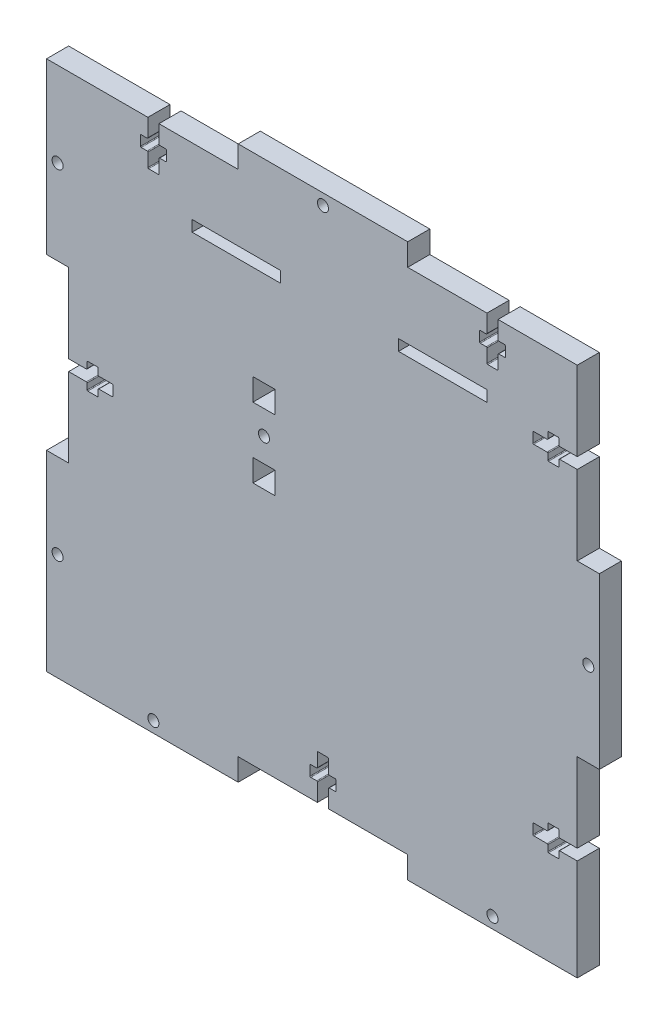
from build123d import *

# Parameters (mm, degrees)
BOX_SIDE_DEPTH       = 6
SKETCH2_R            = 1.5
SCREW_CUT_OUTS_DEPTH = 107.235587258
SKETCH3_R            = 1.5
SKETCH3_W            = 24
SKETCH3_H            = 3
SKETCH3_W_2          = 6
SKETCH3_H_2          = 6
GROOVES_DEPTH        = 107.235587258


with BuildPart() as part:
    # Sketch1 → Box Side (new body)
    with BuildSketch(Plane.XY):
        Polygon((-69, 69), (-23, 69), (-23, 75), (23, 75), (23, 69), (69, 69), (69, 23), (75, 23), (75, -23), (69, -23), (69, -69), (69, -75), (23, -75), (23, -69), (-23, -69), (-23, -75), (-69, -75), (-75, -75), (-75, -69), (-75, -23), (-69, -23), (-69, 23), (-75, 23), (-75, 69), align=None)
    extrude(amount=BOX_SIDE_DEPTH)

    # Sketch2 → Screw Cut-outs (cut, through all)
    with BuildSketch(Plane.XY.offset(6)):
        with Locations((0, 72)):
            Circle(SKETCH2_R)
        with Locations((72, 0)):
            Circle(SKETCH2_R)
        with Locations((-46, -72)):
            Circle(SKETCH2_R)
        with Locations((46, -72)):
            Circle(SKETCH2_R)
        with Locations((-72, 46)):
            Circle(SKETCH2_R)
        with Locations((-72, -46)):
            Circle(SKETCH2_R)
        with BuildLine():
            Line((-44.5, 69), (-44.5, 64.2))
            ThreePointArc((-44.5, 64.2), (-44.441421356, 64.058578644), (-44.3, 64))
            Line((-44.3, 64), (-42.7, 64))
            ThreePointArc((-42.7, 64), (-42.558578644, 63.941421356), (-42.5, 63.8))
            Line((-42.5, 63.8), (-42.5, 61.2))
            ThreePointArc((-42.5, 61.2), (-42.558578644, 61.058578644), (-42.7, 61))
            Line((-42.7, 61), (-44.3, 61))
            ThreePointArc((-44.3, 61), (-44.441421356, 60.941421356), (-44.5, 60.8))
            Line((-44.5, 60.8), (-44.5, 57.2))
            ThreePointArc((-44.5, 57.2), (-44.558578644, 57.058578644), (-44.7, 57))
            Line((-44.7, 57), (-47.3, 57))
            ThreePointArc((-47.3, 57), (-47.441421356, 57.058578644), (-47.5, 57.2))
            Line((-47.5, 57.2), (-47.5, 60.8))
            ThreePointArc((-47.5, 60.8), (-47.558578644, 60.941421356), (-47.7, 61))
            Line((-47.7, 61), (-49.3, 61))
            ThreePointArc((-49.3, 61), (-49.441421356, 61.058578644), (-49.5, 61.2))
            Line((-49.5, 61.2), (-49.5, 63.8))
            ThreePointArc((-49.5, 63.8), (-49.441421356, 63.941421356), (-49.3, 64))
            Line((-49.3, 64), (-47.7, 64))
            ThreePointArc((-47.7, 64), (-47.558578644, 64.058578644), (-47.5, 64.2))
            Line((-47.5, 64.2), (-47.5, 69))
            Line((-47.5, 69), (-44.5, 69))
        make_face()
        with BuildLine():
            Line((47.5, 69), (47.5, 64.2))
            ThreePointArc((47.5, 64.2), (47.558578644, 64.058578644), (47.7, 64))
            Line((47.7, 64), (49.3, 64))
            ThreePointArc((49.3, 64), (49.441421356, 63.941421356), (49.5, 63.8))
            Line((49.5, 63.8), (49.5, 61.2))
            ThreePointArc((49.5, 61.2), (49.441421356, 61.058578644), (49.3, 61))
            Line((49.3, 61), (47.7, 61))
            ThreePointArc((47.7, 61), (47.558578644, 60.941421356), (47.5, 60.8))
            Line((47.5, 60.8), (47.5, 57.2))
            ThreePointArc((47.5, 57.2), (47.441421356, 57.058578644), (47.3, 57))
            Line((47.3, 57), (44.7, 57))
            ThreePointArc((44.7, 57), (44.558578644, 57.058578644), (44.5, 57.2))
            Line((44.5, 57.2), (44.5, 60.8))
            ThreePointArc((44.5, 60.8), (44.441421356, 60.941421356), (44.3, 61))
            Line((44.3, 61), (42.7, 61))
            ThreePointArc((42.7, 61), (42.558578644, 61.058578644), (42.5, 61.2))
            Line((42.5, 61.2), (42.5, 63.8))
            ThreePointArc((42.5, 63.8), (42.558578644, 63.941421356), (42.7, 64))
            Line((42.7, 64), (44.3, 64))
            ThreePointArc((44.3, 64), (44.441421356, 64.058578644), (44.5, 64.2))
            Line((44.5, 64.2), (44.5, 69))
            Line((44.5, 69), (47.5, 69))
        make_face()
        with BuildLine():
            Line((69, 44.5), (64.2, 44.5))
            ThreePointArc((64.2, 44.5), (64.058578644, 44.441421356), (64, 44.3))
            Line((64, 44.3), (64, 42.7))
            ThreePointArc((64, 42.7), (63.941421356, 42.558578644), (63.8, 42.5))
            Line((63.8, 42.5), (61.2, 42.5))
            ThreePointArc((61.2, 42.5), (61.058578644, 42.558578644), (61, 42.7))
            Line((61, 42.7), (61, 44.3))
            ThreePointArc((61, 44.3), (60.941421356, 44.441421356), (60.8, 44.5))
            Line((60.8, 44.5), (57.2, 44.5))
            ThreePointArc((57.2, 44.5), (57.058578644, 44.558578644), (57, 44.7))
            Line((57, 44.7), (57, 47.3))
            ThreePointArc((57, 47.3), (57.058578644, 47.441421356), (57.2, 47.5))
            Line((57.2, 47.5), (60.8, 47.5))
            ThreePointArc((60.8, 47.5), (60.941421356, 47.558578644), (61, 47.7))
            Line((61, 47.7), (61, 49.3))
            ThreePointArc((61, 49.3), (61.058578644, 49.441421356), (61.2, 49.5))
            Line((61.2, 49.5), (63.8, 49.5))
            ThreePointArc((63.8, 49.5), (63.941421356, 49.441421356), (64, 49.3))
            Line((64, 49.3), (64, 47.7))
            ThreePointArc((64, 47.7), (64.058578644, 47.558578644), (64.2, 47.5))
            Line((64.2, 47.5), (69, 47.5))
            Line((69, 47.5), (69, 44.5))
        make_face()
        with BuildLine():
            Line((69, -47.5), (64.2, -47.5))
            ThreePointArc((64.2, -47.5), (64.058578644, -47.558578644), (64, -47.7))
            Line((64, -47.7), (64, -49.3))
            ThreePointArc((64, -49.3), (63.941421356, -49.441421356), (63.8, -49.5))
            Line((63.8, -49.5), (61.2, -49.5))
            ThreePointArc((61.2, -49.5), (61.058578644, -49.441421356), (61, -49.3))
            Line((61, -49.3), (61, -47.7))
            ThreePointArc((61, -47.7), (60.941421356, -47.558578644), (60.8, -47.5))
            Line((60.8, -47.5), (57.2, -47.5))
            ThreePointArc((57.2, -47.5), (57.058578644, -47.441421356), (57, -47.3))
            Line((57, -47.3), (57, -44.7))
            ThreePointArc((57, -44.7), (57.058578644, -44.558578644), (57.2, -44.5))
            Line((57.2, -44.5), (60.8, -44.5))
            ThreePointArc((60.8, -44.5), (60.941421356, -44.441421356), (61, -44.3))
            Line((61, -44.3), (61, -42.7))
            ThreePointArc((61, -42.7), (61.058578644, -42.558578644), (61.2, -42.5))
            Line((61.2, -42.5), (63.8, -42.5))
            ThreePointArc((63.8, -42.5), (63.941421356, -42.558578644), (64, -42.7))
            Line((64, -42.7), (64, -44.3))
            ThreePointArc((64, -44.3), (64.058578644, -44.441421356), (64.2, -44.5))
            Line((64.2, -44.5), (69, -44.5))
            Line((69, -44.5), (69, -47.5))
        make_face()
        with BuildLine():
            Line((-1.5, -69), (1.5, -69))
            Line((1.5, -69), (1.5, -64.2))
            ThreePointArc((1.5, -64.2), (1.558578644, -64.058578644), (1.7, -64))
            Line((1.7, -64), (3.3, -64))
            ThreePointArc((3.3, -64), (3.441421356, -63.941421356), (3.5, -63.8))
            Line((3.5, -63.8), (3.5, -61.2))
            ThreePointArc((3.5, -61.2), (3.441421356, -61.058578644), (3.3, -61))
            Line((3.3, -61), (1.7, -61))
            ThreePointArc((1.7, -61), (1.558578644, -60.941421356), (1.5, -60.8))
            Line((1.5, -60.8), (1.5, -57.2))
            ThreePointArc((1.5, -57.2), (1.441421356, -57.058578644), (1.3, -57))
            Line((1.3, -57), (-1.3, -57))
            ThreePointArc((-1.3, -57), (-1.441421356, -57.058578644), (-1.5, -57.2))
            Line((-1.5, -57.2), (-1.5, -60.8))
            ThreePointArc((-1.5, -60.8), (-1.558578644, -60.941421356), (-1.7, -61))
            Line((-1.7, -61), (-3.3, -61))
            ThreePointArc((-3.3, -61), (-3.441421356, -61.058578644), (-3.5, -61.2))
            Line((-3.5, -61.2), (-3.5, -63.8))
            ThreePointArc((-3.5, -63.8), (-3.441421356, -63.941421356), (-3.3, -64))
            Line((-3.3, -64), (-1.7, -64))
            ThreePointArc((-1.7, -64), (-1.558578644, -64.058578644), (-1.5, -64.2))
            Line((-1.5, -64.2), (-1.5, -69))
        make_face()
        with BuildLine():
            Line((-69, -1.5), (-64.2, -1.5))
            ThreePointArc((-64.2, -1.5), (-64.058578644, -1.558578644), (-64, -1.7))
            Line((-64, -1.7), (-64, -3.3))
            ThreePointArc((-64, -3.3), (-63.941421356, -3.441421356), (-63.8, -3.5))
            Line((-63.8, -3.5), (-61.2, -3.5))
            ThreePointArc((-61.2, -3.5), (-61.058578644, -3.441421356), (-61, -3.3))
            Line((-61, -3.3), (-61, -1.7))
            ThreePointArc((-61, -1.7), (-60.941421356, -1.558578644), (-60.8, -1.5))
            Line((-60.8, -1.5), (-57.2, -1.5))
            ThreePointArc((-57.2, -1.5), (-57.058578644, -1.441421356), (-57, -1.3))
            Line((-57, -1.3), (-57, 1.3))
            ThreePointArc((-57, 1.3), (-57.058578644, 1.441421356), (-57.2, 1.5))
            Line((-57.2, 1.5), (-60.8, 1.5))
            ThreePointArc((-60.8, 1.5), (-60.941421356, 1.558578644), (-61, 1.7))
            Line((-61, 1.7), (-61, 3.3))
            ThreePointArc((-61, 3.3), (-61.058578644, 3.441421356), (-61.2, 3.5))
            Line((-61.2, 3.5), (-63.8, 3.5))
            ThreePointArc((-63.8, 3.5), (-63.941421356, 3.441421356), (-64, 3.3))
            Line((-64, 3.3), (-64, 1.7))
            ThreePointArc((-64, 1.7), (-64.058578644, 1.558578644), (-64.2, 1.5))
            Line((-64.2, 1.5), (-69, 1.5))
            Line((-69, 1.5), (-69, -1.5))
        make_face()
    extrude(amount=-SCREW_CUT_OUTS_DEPTH, mode=Mode.SUBTRACT)

    # Sketch3 → Grooves (cut, through all)
    with BuildSketch(Plane.XY.offset(6)):
        with Locations((-16, 9.82)):
            Circle(SKETCH3_R)
        with Locations((32.5, 49.5)):
            Rectangle(SKETCH3_W, SKETCH3_H)
        with Locations((-16, 19.32)):
            Rectangle(SKETCH3_W_2, SKETCH3_H_2)
        with Locations((-16, 0.32)):
            Rectangle(SKETCH3_W_2, SKETCH3_H_2)
        with Locations((-23.5, 49.5)):
            Rectangle(SKETCH3_W, SKETCH3_H)
    extrude(amount=-GROOVES_DEPTH, mode=Mode.SUBTRACT)


solid = part.part
